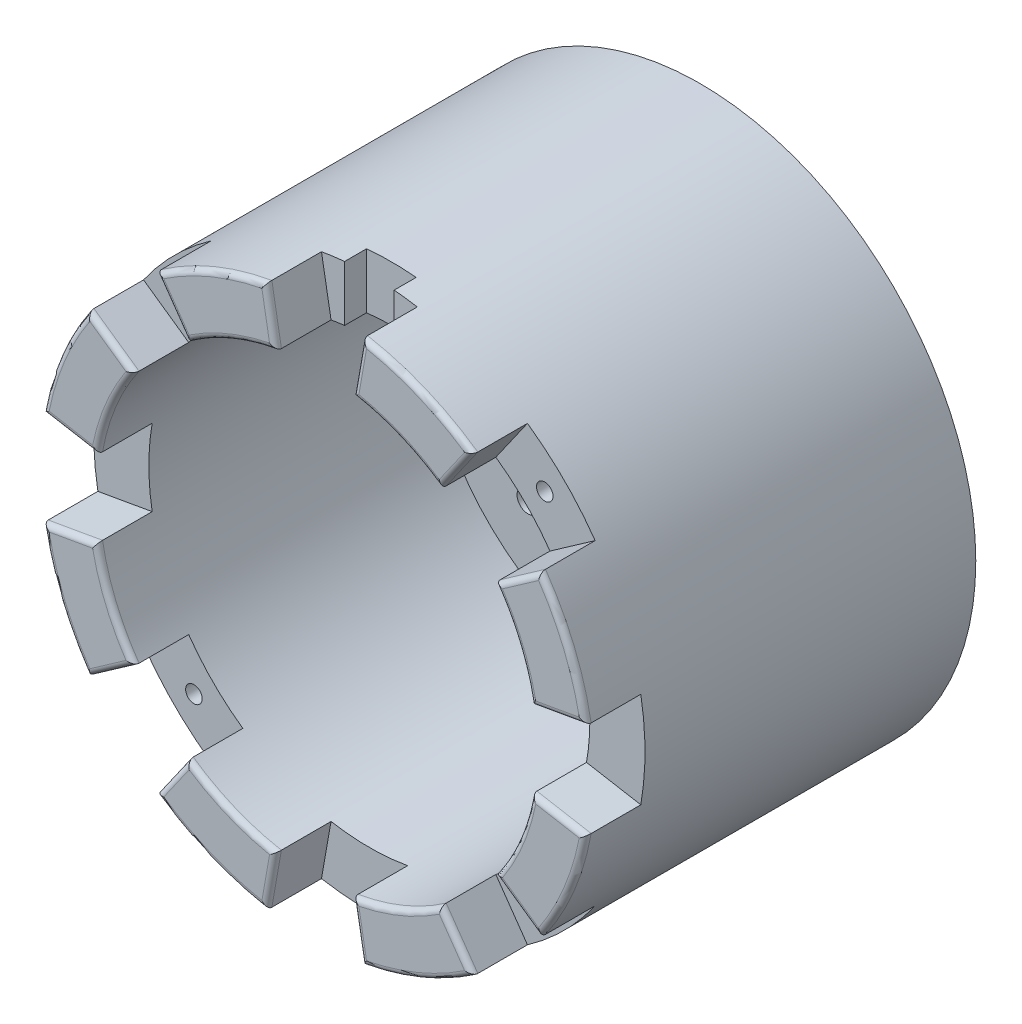
from build123d import *

# Parameters (mm, degrees)
CROQUIS1_R              = 50
CROQUIS1_R_2            = 15.5
SALIENTE_EXTRUIR1_DEPTH = 70
CROQUIS2_R              = 40
CORTAR_EXTRUIR1_DEPTH   = 50
CROQUIS3_R              = 17.5
CORTAR_EXTRUIR2_DEPTH   = 10
CROQUIS4_R              = 40
CROQUIS4_W              = 5
CROQUIS4_H              = 10
CROQUIS4_W_2            = 10
CROQUIS4_H_2            = 5
CROQUIS4_R_2            = 15.5
CORTAR_EXTRUIR3_DEPTH   = 10
CROQUIS5_R              = 2
CORTAR_EXTRUIR4_DEPTH   = 93.736184955
CROQUIS6_R              = 5
CORTAR_EXTRUIR5_DEPTH   = 5
CORTAR_EXTRUIR6_DEPTH   = 10
REDONDEO2_R             = 1
CORTAR_EXTRUIR7_START   = -10
CROQUIS8_W              = 9
CROQUIS8_H              = 20
CORTAR_EXTRUIR7_DEPTH   = 4
CROQUIS9_R              = 1.5
CORTAR_EXTRUIR8_DEPTH   = 20


with BuildPart() as part:
    # Croquis1 → Saliente-Extruir1 (new body)
    with BuildSketch(Plane.XY):
        Circle(CROQUIS1_R)
        Circle(CROQUIS1_R_2, mode=Mode.SUBTRACT)
    extrude(amount=SALIENTE_EXTRUIR1_DEPTH)

    # Croquis2 → Cortar-Extruir1 (cut)
    with BuildSketch(Plane.XY.offset(70)):
        Circle(CROQUIS2_R)
    extrude(amount=-CORTAR_EXTRUIR1_DEPTH, mode=Mode.SUBTRACT)

    # Croquis3 → Cortar-Extruir2 (cut)
    with BuildSketch(Plane(origin=(0, 0, 0), x_dir=(-1, 0, 0), z_dir=(0, 0, -1))):
        Circle(CROQUIS3_R)
    extrude(amount=-CORTAR_EXTRUIR2_DEPTH, mode=Mode.SUBTRACT)

    # Croquis4 → Cortar-Extruir3 (cut)
    with BuildSketch(Plane.XY.offset(20)):
        Circle(CROQUIS4_R)
        with Locations((0, 27.5)):
            Rectangle(CROQUIS4_W, CROQUIS4_H, mode=Mode.SUBTRACT)
        with Locations((27.5, 0)):
            Rectangle(CROQUIS4_W_2, CROQUIS4_H_2, mode=Mode.SUBTRACT)
        with Locations((0, -27.5)):
            Rectangle(CROQUIS4_W, CROQUIS4_H, mode=Mode.SUBTRACT)
        with Locations((-27.5, 0)):
            Rectangle(CROQUIS4_W_2, CROQUIS4_H_2, mode=Mode.SUBTRACT)
        Circle(CROQUIS4_R_2, mode=Mode.SUBTRACT)
    extrude(amount=-CORTAR_EXTRUIR3_DEPTH, mode=Mode.SUBTRACT)

    # Croquis5 → Cortar-Extruir4 (cut, through all)
    with BuildSketch(Plane.XY.offset(10)):
        with Locations((21.213203436, 21.213203436)):
            Circle(CROQUIS5_R)
        with Locations((21.213203436, -21.213203436)):
            Circle(CROQUIS5_R)
        with Locations((-21.213203436, -21.213203436)):
            Circle(CROQUIS5_R)
        with Locations((-21.213203436, 21.213203436)):
            Circle(CROQUIS5_R)
    extrude(amount=-CORTAR_EXTRUIR4_DEPTH, mode=Mode.SUBTRACT)

    # Croquis6 → Cortar-Extruir5 (cut)
    with BuildSketch(Plane(origin=(0, 0, 0), x_dir=(-1, 0, 0), z_dir=(0, 0, -1))):
        with Locations((-21.213203436, 21.213203436)):
            Circle(CROQUIS6_R)
        with Locations((21.486974797, 21.486974797)):
            Circle(CROQUIS6_R)
        with Locations((21.760746158, -21.213203436)):
            Circle(CROQUIS6_R)
        with Locations((-20.939432074, -21.486974797)):
            Circle(CROQUIS6_R)
    extrude(amount=-CORTAR_EXTRUIR5_DEPTH, mode=Mode.SUBTRACT)

    # Croquis7 → Cortar-Extruir6 (cut)
    with BuildSketch(Plane.XY.offset(70)):
        with BuildLine():
            ThreePointArc((-6.945927107, 39.39231012), (0, 40), (6.945927107, 39.39231012))
            Line((6.945927107, 39.39231012), (8.682408883, 49.240387651))
            ThreePointArc((8.682408883, 49.240387651), (0, 50), (-8.682408883, 49.240387651))
            Line((-8.682408883, 49.240387651), (-6.945927107, 39.39231012))
        make_face()
        with BuildLine():
            ThreePointArc((22.943057454, 32.766081772), (28.284271247, 28.284271247), (32.766081772, 22.943057454))
            Line((32.766081772, 22.943057454), (40.957602214, 28.678821818))
            ThreePointArc((40.957602214, 28.678821818), (35.355339059, 35.355339059), (28.678821818, 40.957602214))
            Line((28.678821818, 40.957602214), (22.943057454, 32.766081772))
        make_face()
        with BuildLine():
            ThreePointArc((39.39231012, 6.945927107), (40, 0), (39.39231012, -6.945927107))
            Line((39.39231012, -6.945927107), (49.240387651, -8.682408883))
            ThreePointArc((49.240387651, -8.682408883), (50, 0), (49.240387651, 8.682408883))
            Line((49.240387651, 8.682408883), (39.39231012, 6.945927107))
        make_face()
        with BuildLine():
            ThreePointArc((32.766081772, -22.943057454), (28.284271247, -28.284271247), (22.943057454, -32.766081772))
            Line((22.943057454, -32.766081772), (28.678821818, -40.957602214))
            ThreePointArc((28.678821818, -40.957602214), (35.355339059, -35.355339059), (40.957602214, -28.678821818))
            Line((40.957602214, -28.678821818), (32.766081772, -22.943057454))
        make_face()
        with BuildLine():
            ThreePointArc((6.945927107, -39.39231012), (0, -40), (-6.945927107, -39.39231012))
            Line((-6.945927107, -39.39231012), (-8.682408883, -49.240387651))
            ThreePointArc((-8.682408883, -49.240387651), (0, -50), (8.682408883, -49.240387651))
            Line((8.682408883, -49.240387651), (6.945927107, -39.39231012))
        make_face()
        with BuildLine():
            ThreePointArc((-22.943057454, -32.766081772), (-28.284271247, -28.284271247), (-32.766081772, -22.943057454))
            Line((-32.766081772, -22.943057454), (-40.957602214, -28.678821818))
            ThreePointArc((-40.957602214, -28.678821818), (-35.355339059, -35.355339059), (-28.678821818, -40.957602214))
            Line((-28.678821818, -40.957602214), (-22.943057454, -32.766081772))
        make_face()
        with BuildLine():
            ThreePointArc((-39.39231012, -6.945927107), (-40, 0), (-39.39231012, 6.945927107))
            Line((-39.39231012, 6.945927107), (-49.240387651, 8.682408883))
            ThreePointArc((-49.240387651, 8.682408883), (-50, 0), (-49.240387651, -8.682408883))
            Line((-49.240387651, -8.682408883), (-39.39231012, -6.945927107))
        make_face()
        with BuildLine():
            ThreePointArc((-32.766081772, 22.943057454), (-28.284271247, 28.284271247), (-22.943057454, 32.766081772))
            Line((-22.943057454, 32.766081772), (-28.678821818, 40.957602214))
            ThreePointArc((-28.678821818, 40.957602214), (-35.355339059, 35.355339059), (-40.957602214, 28.678821818))
            Line((-40.957602214, 28.678821818), (-32.766081772, 22.943057454))
        make_face()
    extrude(amount=-CORTAR_EXTRUIR6_DEPTH, mode=Mode.SUBTRACT)

    # Redondeo2
    redondeo2_edges = [part.edges().sort_by_distance(p)[0] for p in [
        (7.814167995, 44.316348886, 70),
        (19.134171618, 46.193976626, 70),
        (25.810939636, 36.861841993, 70),
        (15.307337295, 36.9551813, 70),
        (36.861841993, 25.810939636, 70),
        (46.193976626, 19.134171618, 70),
        (44.316348886, 7.814167995, 70),
        (36.9551813, 15.307337295, 70),
        (44.316348886, -7.814167995, 70),
        (46.193976626, -19.134171618, 70),
        (36.861841993, -25.810939636, 70),
        (36.9551813, -15.307337295, 70),
        (19.134171618, -46.193976626, 70),
        (7.814167995, -44.316348886, 70),
        (15.307337295, -36.9551813, 70),
        (25.810939636, -36.861841993, 70),
        (-7.814167995, -44.316348886, 70),
        (-19.134171618, -46.193976626, 70),
        (-25.810939636, -36.861841993, 70),
        (-15.307337295, -36.9551813, 70),
        (-19.134171618, 46.193976626, 70),
        (-7.814167995, 44.316348886, 70),
        (-15.307337295, 36.9551813, 70),
        (-25.810939636, 36.861841993, 70),
        (-36.861841993, -25.810939636, 70),
        (-46.193976626, -19.134171618, 70),
        (-44.316348886, -7.814167995, 70),
        (-36.9551813, -15.307337295, 70),
        (-44.316348886, 7.814167995, 70),
        (-46.193976626, 19.134171618, 70),
        (-36.861841993, 25.810939636, 70),
        (-36.9551813, 15.307337295, 70),
        (0, -22.5, 20),
        (2.5, -27.5, 20),
        (0, -32.5, 20),
        (-2.5, -27.5, 20),
        (-32.5, 0, 20),
        (-27.5, 2.5, 20),
        (-22.5, 0, 20),
        (-27.5, -2.5, 20),
        (22.5, 0, 20),
        (27.5, 2.5, 20),
        (32.5, 0, 20),
        (27.5, -2.5, 20),
        (0, 22.5, 20),
        (-2.5, 27.5, 20),
        (0, 32.5, 20),
        (2.5, 27.5, 20),
    ]]
    fillet(redondeo2_edges, radius=REDONDEO2_R)

    # Croquis8 → Cortar-Extruir7 (cut)
    with BuildSketch(Plane.XY.offset(70).offset(CORTAR_EXTRUIR7_START)):
        with Locations((0, 45)):
            Rectangle(CROQUIS8_W, CROQUIS8_H)
    extrude(amount=-CORTAR_EXTRUIR7_DEPTH, mode=Mode.SUBTRACT)

    # Croquis9 → Cortar-Extruir8 (cut)
    with BuildSketch(Plane.XY.offset(60)):
        with Locations((31.819805153, 31.819805153)):
            Circle(CROQUIS9_R)
        with Locations((31.819805153, -31.819805153)):
            Circle(CROQUIS9_R)
        with Locations((-31.819805153, -31.819805153)):
            Circle(CROQUIS9_R)
        with Locations((-31.819805153, 31.819805153)):
            Circle(CROQUIS9_R)
    extrude(amount=-CORTAR_EXTRUIR8_DEPTH, mode=Mode.SUBTRACT)


solid = part.part
